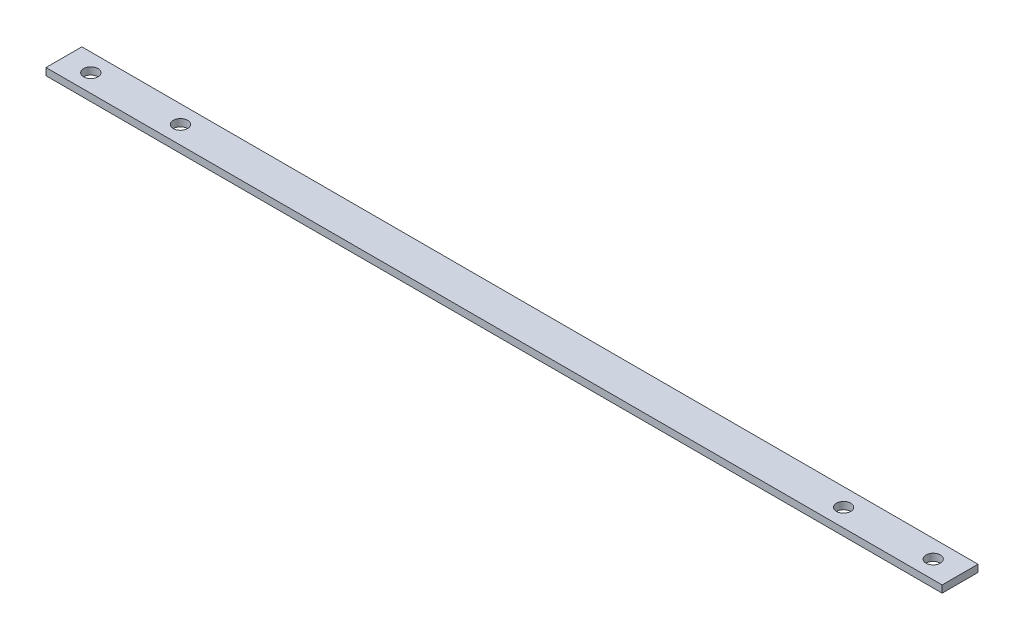
from build123d import *

# Parameters (mm, degrees)
SKETCH_1_W          = 20
SKETCH_1_H          = 4
EXTRUDE_1_DEPTH     = 500
SKETCH_2_R          = 4
CUT_EXTRUDE_1_DEPTH = 501.415827088


with BuildPart() as part:
    # Эскиз1 → Вытянуть-Тонкостенный1 (new body)
    with BuildSketch(Plane(origin=(0, 0, 0), x_dir=(0, 0, -1), z_dir=(1, 0, 0))):
        with Locations((10, -2)):
            Rectangle(SKETCH_1_W, SKETCH_1_H)
    extrude(amount=EXTRUDE_1_DEPTH)

    # Эскиз2 → Вырез-Вытянуть1 (cut, through all)
    with BuildSketch(Plane(origin=(0, 0, 0), x_dir=(1, 0, 0), z_dir=(0, 1, 0))):
        with Locations((15, 10)):
            Circle(SKETCH_2_R)
        with Locations((65, 10)):
            Circle(SKETCH_2_R)
        with Locations((435, 10)):
            Circle(SKETCH_2_R)
        with Locations((485, 10)):
            Circle(SKETCH_2_R)
    extrude(amount=-CUT_EXTRUDE_1_DEPTH, mode=Mode.SUBTRACT)


solid = part.part
